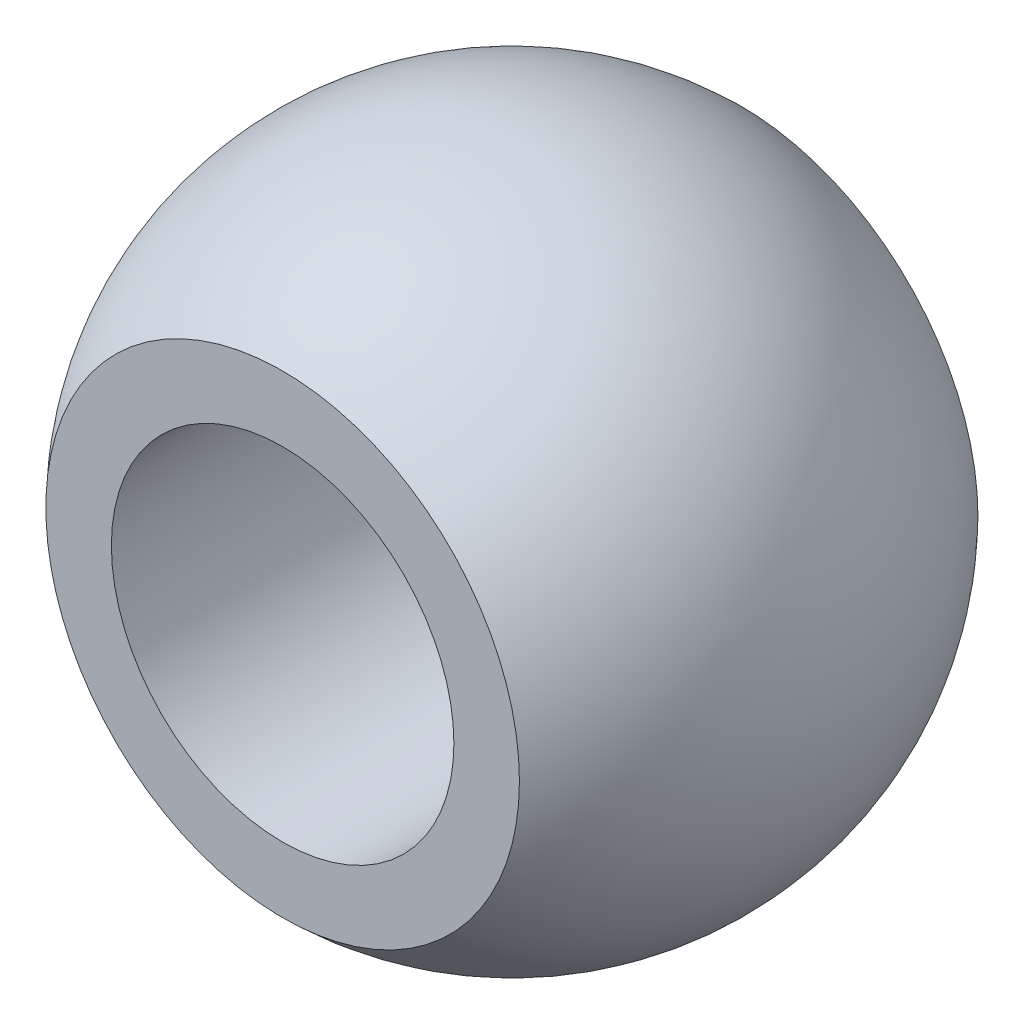
from build123d import *

# Parameters (mm, degrees)
CUT_EXTRUDE1_DEPTH      = 16.874245651
CUT_EXTRUDE1_DEPTH_BACK = 16.874245651
SKETCH2_R               = 4.7625
CUT_EXTRUDE2_DEPTH      = 16.142994048
CUT_EXTRUDE2_DEPTH_BACK = 16.142994048
SKETCH3_W               = 2.910883596
SKETCH3_H               = 13.169145758
SKETCH3_W_2             = 2.910883595


with BuildPart() as part:
    # Sketch1 → Revolve1 (revolve)
    with BuildSketch(Plane(origin=(0, 0, 0), x_dir=(1, 0, 0), z_dir=(0, 1, 0))):
        with BuildLine():
            Line((0, 9.165), (0, -9.165))
            ThreePointArc((0, -9.165), (-9.165, 0), (0, 9.165))
        make_face()
    revolve(axis=Axis((0, 0, -9.165), (0, 0, 1)))

    # Sketch2 → Cut-Extrude1 (cut, two sides: drawn at the far end of the back side and taken through both)
    with BuildSketch(Plane.XY.offset(-CUT_EXTRUDE1_DEPTH_BACK)):
        Circle(SKETCH2_R)
    extrude(amount=CUT_EXTRUDE1_DEPTH + CUT_EXTRUDE1_DEPTH_BACK, mode=Mode.SUBTRACT)

    # Sketch3 → Cut-Extrude2 (cut, two sides: drawn at the far end of the back side and taken through both)
    with BuildSketch(Plane(origin=(0, 0, 0), x_dir=(0, 0, -1), z_dir=(1, 0, 0)).offset(-CUT_EXTRUDE2_DEPTH_BACK)):
        with Locations((-7.830441798, 0)):
            Rectangle(SKETCH3_W, SKETCH3_H)
        with Locations((7.830441798, 0)):
            Rectangle(SKETCH3_W_2, SKETCH3_H)
    extrude(amount=CUT_EXTRUDE2_DEPTH + CUT_EXTRUDE2_DEPTH_BACK, mode=Mode.SUBTRACT)


solid = part.part
